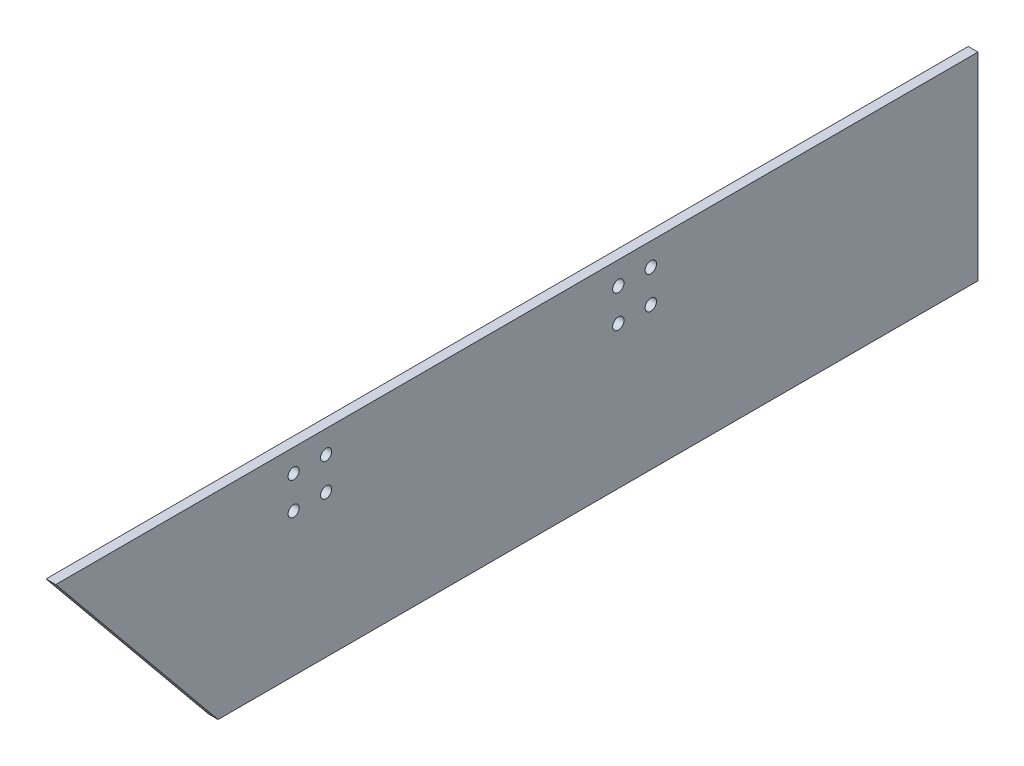
from build123d import *

# Parameters (mm, degrees)
SKETCH1_W                      = 3
SKETCH1_H                      = 76
BOSS_EXTRUDE1_DEPTH            = 220
M3_CLEARANCE_HOLE1_D           = 3.4
M3_CLEARANCE_HOLE1_CSINK_D     = 3.45
M3_CLEARANCE_HOLE1_CSINK_ANGLE = 90
SKETCH4_W                      = 220
SKETCH4_H                      = 15
CUT_EXTRUDE1_DEPTH             = 233.776717049
SKETCH5_R                      = 1.75
CUT_EXTRUDE2_DEPTH             = 233.776717049
BOSS_EXTRUDE2_START            = -3
SKETCH6_R                      = 1.725
SKETCH6_R_2                    = 1.7
BOSS_EXTRUDE2_DEPTH            = 3
BOSS_EXTRUDE3_DEPTH            = 3


with BuildPart() as part:
    # Sketch1 → Boss-Extrude1 (new body)
    with BuildSketch(Plane.XY):
        with Locations((1.5, 38)):
            Rectangle(SKETCH1_W, SKETCH1_H)
    extrude(amount=BOSS_EXTRUDE1_DEPTH)

    # M3 Clearance Hole1 (through all)
    with Locations(Plane.ZY):
        with Locations((50.754682085, 59), (60.754682085, 59), (60.754682085, 69), (50.754682085, 69), (200.754682085, 59), (200.754682085, 69), (210.754682085, 59), (210.754682085, 69)):
            CounterSinkHole(M3_CLEARANCE_HOLE1_D / 2, M3_CLEARANCE_HOLE1_CSINK_D / 2, counter_sink_angle=M3_CLEARANCE_HOLE1_CSINK_ANGLE)

    # Sketch4 → Cut-Extrude1 (cut, through all)
    with BuildSketch(Plane.ZY):
        with Locations((110, 7.5)):
            Rectangle(SKETCH4_W, SKETCH4_H)
    extrude(amount=-CUT_EXTRUDE1_DEPTH, mode=Mode.SUBTRACT)

    # Sketch5 → Cut-Extrude2 (cut, through all)
    with BuildSketch(Plane.ZY):
        with Locations((110.754682085, 69)):
            Circle(SKETCH5_R)
        with Locations((100.754682085, 69)):
            Circle(SKETCH5_R)
        with Locations((100.754682085, 59)):
            Circle(SKETCH5_R)
        with Locations((110.754682085, 59)):
            Circle(SKETCH5_R)
    extrude(amount=-CUT_EXTRUDE2_DEPTH, mode=Mode.SUBTRACT)

    # Sketch6 → Boss-Extrude2 (add)
    with BuildSketch(Plane.ZY.offset(BOSS_EXTRUDE2_START)):
        with Locations((50.754682085, 59)):
            Circle(SKETCH6_R)
        with Locations((60.754682085, 59)):
            Circle(SKETCH6_R_2)
        with Locations((60.754682085, 69)):
            Circle(SKETCH6_R)
        with Locations((50.754682085, 69)):
            Circle(SKETCH6_R)
    extrude(amount=BOSS_EXTRUDE2_DEPTH)

    # Sketch8 → Boss-Extrude3 (add)
    with BuildSketch(Plane.ZY):
        Polygon((220, 15), (234, 15), (284, 76), (220, 76), align=None)
    extrude(amount=-BOSS_EXTRUDE3_DEPTH)


solid = part.part
